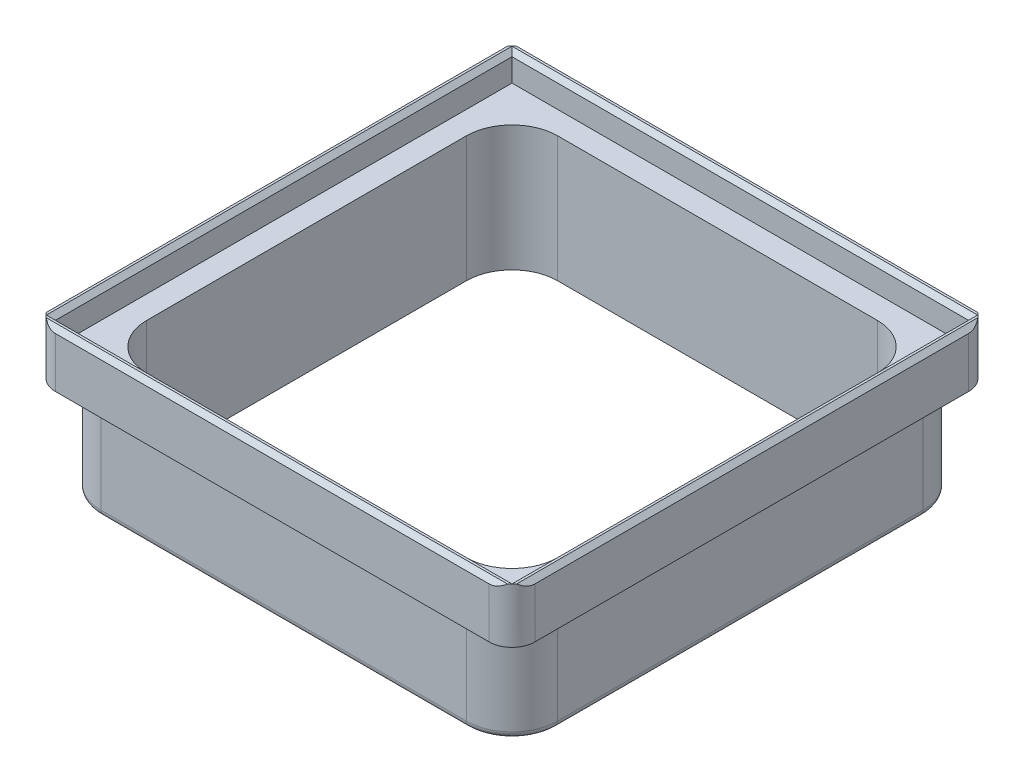
from build123d import *

# Parameters (mm, degrees)
SKETCH1_W               = 200
SKETCH1_H               = 200
BOSS_EXTRUDE1_DEPTH     = 55
FILLET1_R               = 20
SKETCH2_W               = 210
SKETCH2_H               = 210
SKETCH2_W_2             = 200
SKETCH2_H_2             = 200
BOSS_EXTRUDE2_DEPTH     = 12
SKETCH3_W               = 210
SKETCH3_H               = 210
BOSS_EXTRUDE3_DEPTH     = 12
CUT_EXTRUDE1_DEPTH      = 159.350876221
CUT_EXTRUDE1_DEPTH_BACK = 159.350876221
SKETCH5_W               = 180
SKETCH5_H               = 180
CHAMFER1_SIZE           = 2
FILLET2_R               = 10
FILLET3_R               = 3
FILLET4_R               = 20


with BuildPart() as part:
    # Sketch1 → Boss-Extrude1 (new body)
    with BuildSketch(Plane(origin=(0, 0, 0), x_dir=(1, 0, 0), z_dir=(0, 1, 0))):
        Rectangle(SKETCH1_W, SKETCH1_H)
    extrude(amount=-BOSS_EXTRUDE1_DEPTH)

    # Fillet1
    fillet1_edges = [part.edges().sort_by_distance(p)[0] for p in [
        (100, -27.5, 100),
        (-100, -27.5, 100),
        (-100, -27.5, -100),
        (100, -27.5, -100),
    ]]
    fillet(fillet1_edges, radius=FILLET1_R)

    # Sketch3 → Boss-Extrude3 (add)
    with BuildSketch(Plane(origin=(0, 0, 0), x_dir=(1, 0, 0), z_dir=(0, 1, 0))):
        Rectangle(SKETCH3_W, SKETCH3_H)
    extrude(amount=-BOSS_EXTRUDE3_DEPTH)


with BuildPart() as body_2:
    # Sketch2 → Boss-Extrude2 (new body)
    with BuildSketch(Plane(origin=(0, 0, 0), x_dir=(1, 0, 0), z_dir=(0, 1, 0))):
        Rectangle(SKETCH2_W, SKETCH2_H)
        Rectangle(SKETCH2_W_2, SKETCH2_H_2, mode=Mode.SUBTRACT)
    extrude(amount=BOSS_EXTRUDE2_DEPTH)

    # Combine2: union part
    add(part.part)

    # Sketch5 → Cut-Extrude1 (cut, two sides: drawn at the far end of the back side and taken through both)
    with BuildSketch(Plane(origin=(0, 0, 0), x_dir=(1, 0, 0), z_dir=(0, 1, 0)).offset(-CUT_EXTRUDE1_DEPTH_BACK)):
        Rectangle(SKETCH5_W, SKETCH5_H)
    extrude(amount=CUT_EXTRUDE1_DEPTH + CUT_EXTRUDE1_DEPTH_BACK, mode=Mode.SUBTRACT)

    # Chamfer1
    chamfer1_edges = [body_2.edges().sort_by_distance(p)[0] for p in [
        (-105, 12, 0),
        (100, 12, 0),
        (0, 12, 105),
        (0, 12, -100),
        (-100, 12, 0),
        (0, 12, 100),
        (105, 12, 0),
        (0, 12, -105),
    ]]
    chamfer(chamfer1_edges, length=CHAMFER1_SIZE)

    # Fillet2
    # the kernel refuses this fillet: 10 mm, written as the material it takes off along each edge
    with BuildSketch(Plane(origin=(105, 35, 105), x_dir=(-1, 0, 0), z_dir=(0, -1, 0)), Plane(origin=(-105, 35, 105), x_dir=(0, 0, -1), z_dir=(0, -1, 0)), Plane(origin=(-105, -37, -105), x_dir=(0, 0, 1), z_dir=(0, 1, 0))) as fillet2_piece_1:
        with BuildLine():
            CenterArc((FILLET2_R, FILLET2_R), FILLET2_R, 180, 90)
            Line((0, FILLET2_R), (0, 0))
            Line((0, 0), (FILLET2_R, 0))
        make_face()
    extrude(amount=72, mode=Mode.SUBTRACT)
    with BuildSketch(Plane(origin=(105, 35, -105), x_dir=(-1, 0, 0), z_dir=(0, -1, 0))) as fillet2_piece_2:
        with BuildLine():
            CenterArc((FILLET2_R, -FILLET2_R), FILLET2_R, 90, 90)
            Line((0, -FILLET2_R), (0, 0))
            Line((0, 0), (FILLET2_R, 0))
        make_face()
    extrude(amount=72, mode=Mode.SUBTRACT)

    # Fillet3
    fillet3_edges = [body_2.edges().sort_by_distance(p)[0] for p in [
        (100, -55, 0),
        (0, -55, 100),
        (-100, -55, 0),
        (0, -55, -100),
        (94.142135624, -55, -94.142135624),
        (94.142135624, -55, 94.142135624),
        (-94.142135624, -55, 94.142135624),
        (-94.142135624, -55, -94.142135624),
        (0, -12, -100),
        (-94.142135624, -12, -94.142135624),
        (-100, -12, 0),
        (-94.142135624, -12, 94.142135624),
        (0, -12, 100),
        (94.142135624, -12, 94.142135624),
        (100, -12, 0),
        (94.142135624, -12, -94.142135624),
    ]]
    fillet(fillet3_edges, radius=FILLET3_R)

    # Fillet4
    fillet4_edges = [body_2.edges().sort_by_distance(p)[0] for p in [
        (90, -27.5, -90),
        (90, -27.5, 90),
        (-90, -27.5, 90),
        (-90, -27.5, -90),
    ]]
    fillet(fillet4_edges, radius=FILLET4_R)


solid = body_2.part
